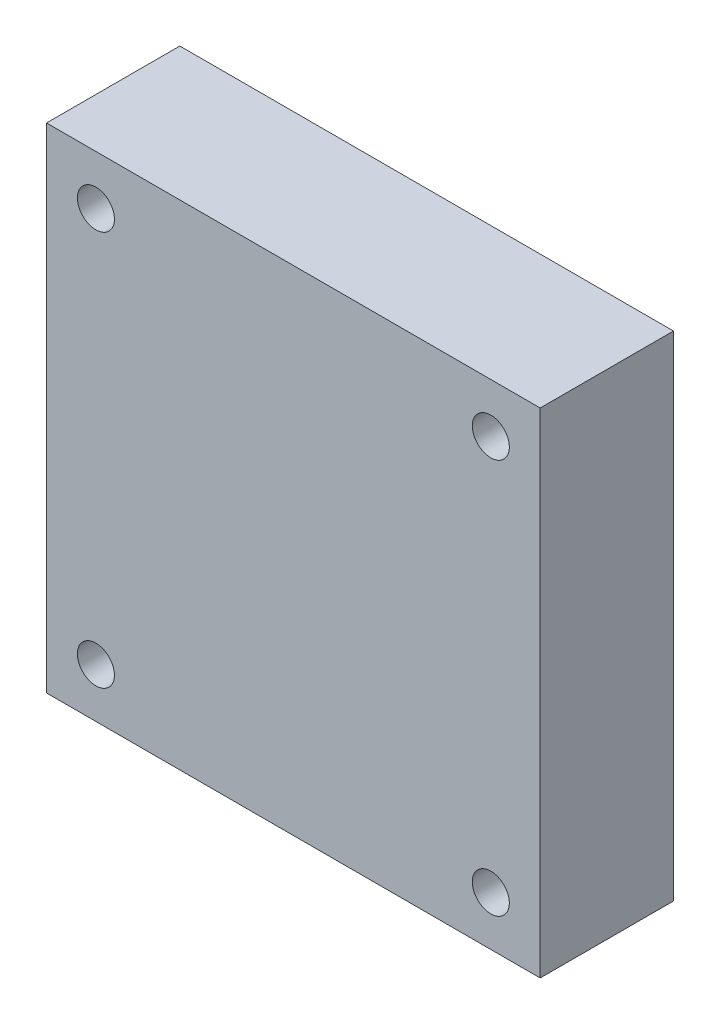
from build123d import *

# Parameters (mm, degrees)
LOFT_START          = -25
LOFT_1_OUTLINE_W    = 40
LOFT_1_OUTLINE_H    = 40
LOFT_1_DEPTH        = 10.8
SKETCH_1_R          = 1.5
CUT_EXTRUDE_1_DEPTH = 25


# Read off the part's stored shape, not the designer's step: По сечениям1
with BuildPart() as part:
    # По сечениям1 outline → По сечениям1 (new body)
    with BuildSketch(Plane.XY.offset(LOFT_START)):
        with Locations((-27.5, -27.5)):
            Rectangle(LOFT_1_OUTLINE_W, LOFT_1_OUTLINE_H)
    extrude(amount=LOFT_1_DEPTH)

    # Эскиз1 → Вырез-Вытянуть1 (cut)
    with BuildSketch(Plane.XY.offset(-14.2)):
        with Locations((-43.5, -11.5)):
            Circle(SKETCH_1_R)
        with Locations(Location((-43.5, -43.5, 0), (0, 0, 180))):
            Circle(SKETCH_1_R)
        with Locations(Location((-11.5, -11.5, 0), (0, 0, 180))):
            Circle(SKETCH_1_R)
        with Locations((-11.5, -43.5)):
            Circle(SKETCH_1_R)
    extrude(amount=-CUT_EXTRUDE_1_DEPTH, mode=Mode.SUBTRACT)


solid = part.part
